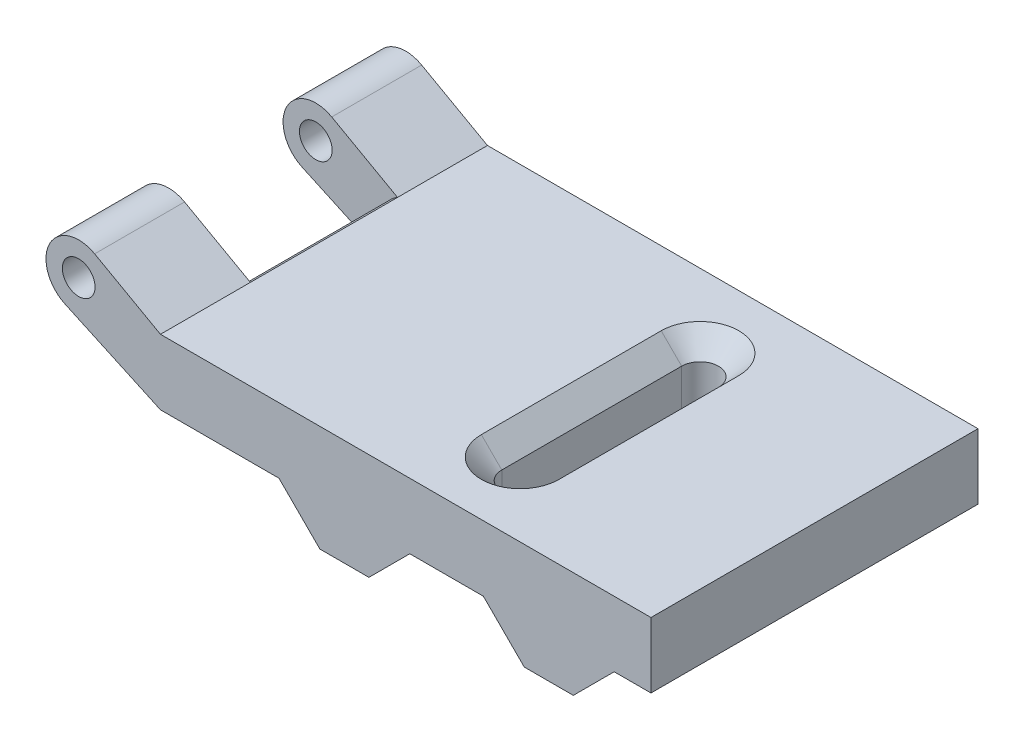
from build123d import *

# Parameters (mm, degrees)
SKETCH1_R           = 2
BOSS_EXTRUDE1_DEPTH = 40
CUT_EXTRUDE1_DEPTH  = 82.663945533
CHAMFER1_SIZE       = 2.5
SKETCH3_W           = 12
SKETCH3_H           = 18
CUT_EXTRUDE2_DEPTH  = 82.663945533
FILLET1_R           = 4


with BuildPart() as part:
    # Sketch1 → Boss-Extrude1 (new body)
    with BuildSketch(Plane.XY):
        with BuildLine():
            Line((10, -9), (24.5, -9))
            Line((24.5, -9), (29.5, -14))
            Line((29.5, -14), (35.5, -14))
            Line((35.5, -14), (40.5, -9))
            Line((40.5, -9), (49.5, -9))
            Line((49.5, -9), (54.5, -14))
            Line((54.5, -14), (60.5, -14))
            Line((60.5, -14), (65.5, -9))
            Line((65.5, -9), (70, -9))
            Line((70, -9), (70, -1))
            Line((70, -1), (10, -1))
            Line((10, -1), (1.949288889, 3.492888894))
            ThreePointArc((1.949288889, 3.492888894), (-3.566315144, 1.811462473), (-1.670874988, -3.634305542))
            Line((-1.670874988, -3.634305542), (10, -9))
        make_face()
        Circle(SKETCH1_R, mode=Mode.SUBTRACT)
    extrude(amount=BOSS_EXTRUDE1_DEPTH)

    # Sketch2 → Cut-Extrude1 (cut, through all)
    with BuildSketch(Plane.XZ.offset(9)):
        with BuildLine():
            Line((47.25, 31), (47.25, 9))
            ThreePointArc((47.25, 9), (45, 6.75), (42.75, 9))
            Line((42.75, 9), (42.75, 31))
            ThreePointArc((42.75, 31), (45, 33.25), (47.25, 31))
        make_face()
    extrude(amount=-CUT_EXTRUDE1_DEPTH, mode=Mode.SUBTRACT)

    # Chamfer1
    chamfer1_edges = [part.edges().sort_by_distance(p)[0] for p in [
        (42.75, -1, 20),
        (45, -1, 6.75),
        (47.25, -1, 20),
        (45, -1, 33.25),
    ]]
    chamfer(chamfer1_edges, length=CHAMFER1_SIZE)

    # Sketch3 → Cut-Extrude2 (cut, through all)
    with BuildSketch(Plane.XZ.offset(9)):
        with Locations((2, 20)):
            Rectangle(SKETCH3_W, SKETCH3_H)
    extrude(amount=-CUT_EXTRUDE2_DEPTH, mode=Mode.SUBTRACT)

    # Fillet1
    # the kernel refuses this fillet: 4 mm, written as the material it takes off along each edge
    with BuildSketch(Plane(origin=(8, 0.116147091, 29), x_dir=(0.8732222234943452, -0.4873222223494347, 0), z_dir=(0, 0, -1))) as fillet1_piece_1:
        with BuildLine():
            CenterArc((5.724945872, 2.05028607), FILLET1_R, 150.835269547, 60)
            Line((2.232056978, 3.999574959), (0, 0))
            Line((0, 0), (2.290367728, 0))
        make_face()
    extrude(amount=18, mode=Mode.SUBTRACT)
    with BuildSketch(Plane(origin=(8, -8.080498341, 11), x_dir=(0.9085763855616094, -0.4177187470054484, 0), z_dir=(0, 0, 1))) as fillet1_piece_2:
        with BuildLine():
            CenterArc((FILLET1_R * 0.640872096444, FILLET1_R), FILLET1_R, 204.690646006, 65.309353994)
            Line((-FILLET1_R * 0.267704289117, FILLET1_R * 0.582281252995), (0, 0))
            Line((0, 0), (FILLET1_R * 0.640872096444, 0))
        make_face()
    extrude(amount=18, mode=Mode.SUBTRACT)


solid = part.part
